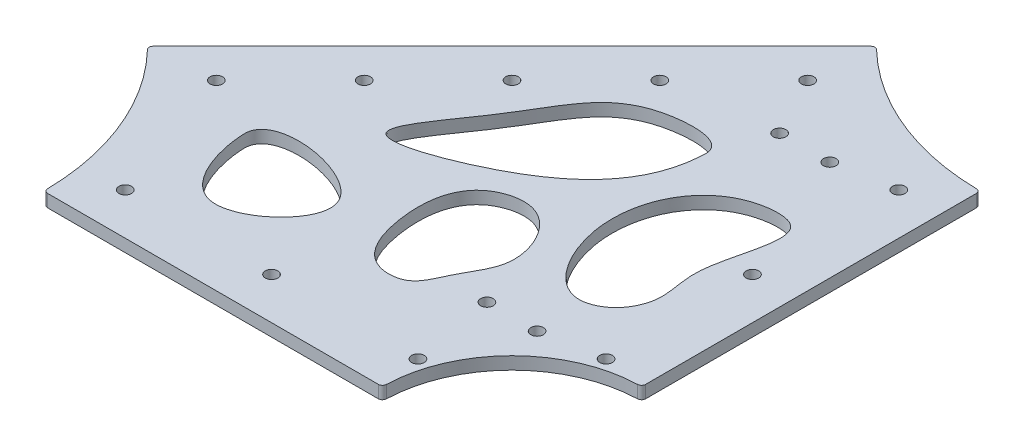
from build123d import *

# Parameters (mm, degrees)
EXTRUDE_1_DEPTH     = 3
SKETCH_2_R          = 60
SKETCH_2_R_2        = 31
CUT_EXTRUDE_1_DEPTH = 220.390691703
SKETCH_3_R          = 1.5
CUT_EXTRUDE_2_DEPTH = 191.220260404
CUT_EXTRUDE_START   = -3
CUT_EXTRUDE_3_DEPTH = 3
FILLET_1_R          = 1


# Read off the part's stored shape, not the designer's step: 切除-拉伸3
with BuildPart() as part:
    # 草图1 → 凸台-拉伸1 (new body)
    with BuildSketch(Plane(origin=(0, 0, 0), x_dir=(1, 0, 0), z_dir=(0, 1, 0))):
        Polygon((147.885822331, -10), (147.885822331, 162.027957955), (-24.142135624, -10), align=None)
    extrude(amount=EXTRUDE_1_DEPTH)

    # 草图2 → 切除-拉伸1 (cut, through all)
    with BuildSketch(Plane(origin=(0, 3, 0), x_dir=(1, 0, 0), z_dir=(0, 1, 0))):
        with Locations((147.885822331, 162.027957955)):
            Circle(SKETCH_2_R)
        with Locations((-24.142135624, -10)):
            Circle(SKETCH_2_R)
        with Locations((147.885822331, -10)):
            Circle(SKETCH_2_R_2)
    extrude(amount=-CUT_EXTRUDE_1_DEPTH, mode=Mode.SUBTRACT)

    # 草图3 → 切除-拉伸2 (cut, through all)
    with BuildSketch(Plane(origin=(0, 3, 0), x_dir=(1, 0, 0), z_dir=(0, 1, 0))):
        with Locations(Location((115.385822331, 0, 0), (0, 0, 270))):
            Circle(SKETCH_3_R)
        with Locations(Location((80.385822331, 0, 0), (0, 0, 270))):
            Circle(SKETCH_3_R)
        with Locations(Location((45.385822331, 0, 0), (0, 0, 270))):
            Circle(SKETCH_3_R)
        with Locations(Location((33.587572106, 33.587572106, 0), (0, 0, 270))):
            Circle(SKETCH_3_R)
        with Locations(Location((51.265241636, 51.265241636, 0), (0, 0, 270))):
            Circle(SKETCH_3_R)
        with Locations(Location((68.942911166, 68.942911166, 0), (0, 0, 270))):
            Circle(SKETCH_3_R)
        with Locations(Location((86.620580695, 86.620580695, 0), (0, 0, 270))):
            Circle(SKETCH_3_R)
        with Locations(Location((104.298250225, 104.298250225, 0), (0, 0, 270))):
            Circle(SKETCH_3_R)
        with Locations(Location((137.885822331, 22.5, 0), (0, 0, 90))):
            Circle(SKETCH_3_R)
        with Locations(Location((137.885822331, 57.5, 0), (0, 0, 90))):
            Circle(SKETCH_3_R)
        with Locations(Location((137.885822331, 92.5, 0), (0, 0, 90))):
            Circle(SKETCH_3_R)
        with Locations(Location((111.885822331, 90, 0), (0, 0, 270))):
            Circle(SKETCH_3_R)
        with Locations(Location((111.885822331, 20, 0), (0, 0, 270))):
            Circle(SKETCH_3_R)
        with Locations(Location((123.885822331, 90, 0), (0, 0, 90))):
            Circle(SKETCH_3_R)
        with Locations(Location((123.885822331, 20, 0), (0, 0, 90))):
            Circle(SKETCH_3_R)
    extrude(amount=-CUT_EXTRUDE_2_DEPTH, mode=Mode.SUBTRACT)

    # 切除-拉伸3 outline → 切除-拉伸3 (cut)
    with BuildSketch(Plane(origin=(0, 3, 0), x_dir=(1, 0, 0), z_dir=(0, 1, 0)).offset(CUT_EXTRUDE_START)):
        with BuildLine():
            add(Edge.make_bspline(
                [(107.258933635, 77.343936504), (106.861115496, 81.449952702), (84.143080775, 81.611762246), (79.12128884, 64.922878035), (56.641094904, 37.250289862), (94.51379987, 50.167307725), (106.828330693, 64.156813109), (107.292522099, 76.997258554), (107.258933635, 77.343936504)],
                knots=[0, 0, 0, 0, 0.108879834, 0.352646081, 0.515155307, 0.685720333, 0.99080709, 1, 1, 1, 1], degree=3))
        make_face()
        with BuildLine():
            add(Edge.make_bspline(
                [(88.260440691, 42.692642695), (84.061577104, 39.265082408), (82.780161964, 27.558864749), (88.002608571, 13.59281611), (99.221115721, 14.151818352), (102.059809279, 22.570570112), (109.056863232, 31.647789519), (101.312029857, 47.626905876), (90.894430167, 44.842785832), (88.260440691, 42.692642695)],
                knots=[0, 0, 0, 0, 0.200201632, 0.380411687, 0.454336449, 0.547770151, 0.674620485, 0.874411497, 1, 1, 1, 1], degree=3))
        make_face()
        with BuildLine():
            add(Edge.make_bspline(
                [(110.00805792, 47.542489479), (111.489833592, 39.243478408), (118.201614065, 28.622441595), (129.148102504, 33.927232535), (132.873326017, 41.599516216), (128.223189281, 53.739111701), (138.835243287, 73.917241433), (114.902579526, 73.015104638), (107.9626382, 58.998313199), (110.00805792, 47.542489479)],
                knots=[0, 0, 0, 0, 0.203400882, 0.252548795, 0.328655402, 0.427644221, 0.641239677, 0.719228637, 1, 1, 1, 1], degree=3))
        make_face()
        with BuildLine():
            add(Edge.make_bspline(
                [(48.020770875, 26.538003152), (47.958938015, 26.032470396), (48.241740663, 18.717682081), (55.385714942, -1.390285274), (88.333867129, 27.329469803), (48.993375924, 34.489822141), (48.020770875, 26.538003152)],
                knots=[0, 0, 0, 0, 0.023861742, 0.315324429, 0.62466477, 1, 1, 1, 1], degree=3))
        make_face()
    extrude(amount=CUT_EXTRUDE_3_DEPTH, mode=Mode.SUBTRACT)

    # 圆角1
    fillet_1_edges = [part.edges().sort_by_distance(p)[0] for p in [
        (147.885822331, 1.5, -102.027957955),
        (105.45941546, 1.5, -119.601551084),
        (35.857864376, 1.5, 10),
        (18.284271247, 1.5, -32.426406871),
        (116.885822331, 1.5, 10),
        (147.885822331, 1.5, -21),
    ]]
    fillet(fillet_1_edges, radius=FILLET_1_R)


solid = part.part
